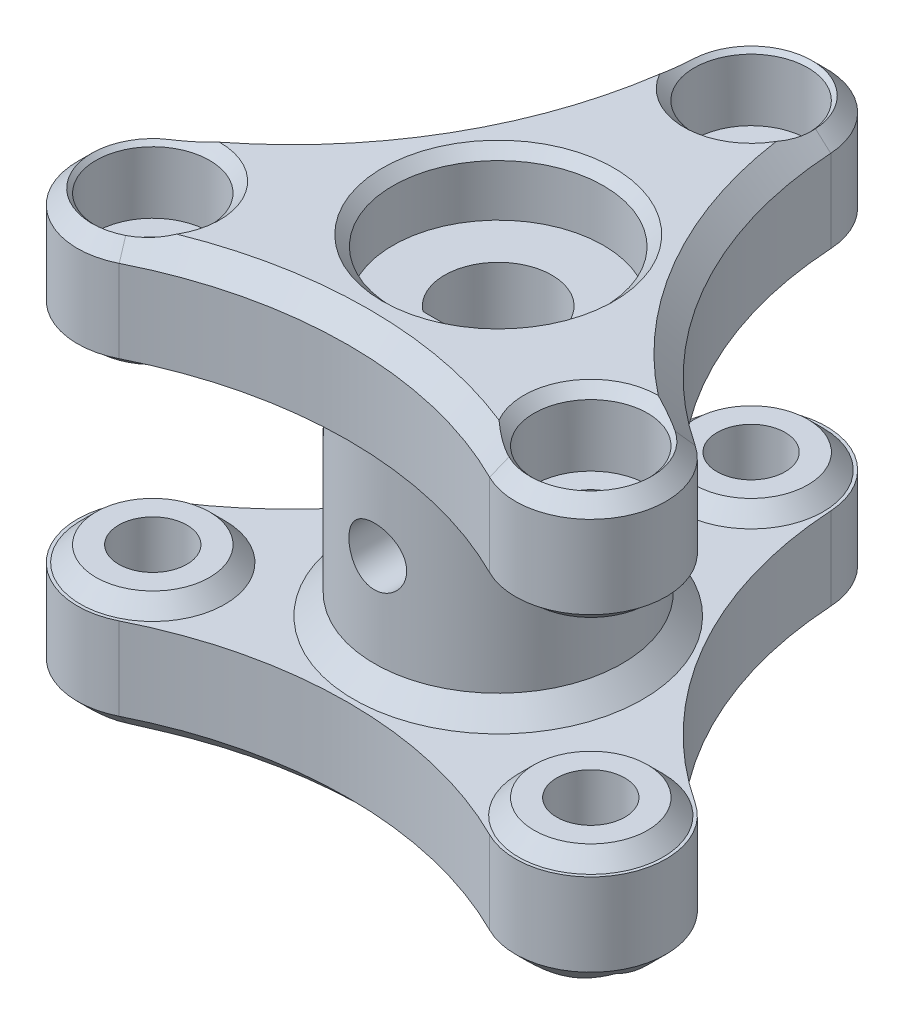
from build123d import *

# Parameters (mm, degrees)
SKETCH1_R           = 1.65
BOSS_EXTRUDE1_DEPTH = 5
SKETCH2_R           = 6
BOSS_EXTRUDE2_DEPTH = 11
SKETCH3_R           = 1.65
BOSS_EXTRUDE3_DEPTH = 5
SKETCH4_R           = 1.4
CUT_EXTRUDE1_DEPTH  = 30.952023249
FILLET1_SIZE        = 1
CUT_EXTRUDE2_DEPTH  = 3
SKETCH8_R           = 2.5
SKETCH8_R_2         = 1.65
BOSS_EXTRUDE5_DEPTH = 0.75
FILLET4_SIZE        = 1
BOSS_EXTRUDE6_START = 0.75
SKETCH9_R           = 2.5
SKETCH9_R_2         = 1.65
BOSS_EXTRUDE6_DEPTH = 0.75
FILLET5_SIZE        = 1
SKETCH12_R          = 2.75
CUT_EXTRUDE5_DEPTH  = 3.5
SKETCH10_R          = 5.1
CUT_EXTRUDE3_DEPTH  = 3
CUT_EXTRUDE4_START  = -3.5
SKETCH11_R          = 5.1
CUT_EXTRUDE4_DEPTH  = 3.5
CHAMFER1_SIZE       = 1
CHAMFER2_SIZE       = 1


with BuildPart() as part:
    # Sketch1 → Boss-Extrude1 (new body)
    with BuildSketch(Plane(origin=(0, 0, 0), x_dir=(1, 0, 0), z_dir=(0, 1, 0))):
        with BuildLine():
            ThreePointArc((-12.615282077, -3.075971531), (-13.76980392, -7.95), (-8.971510525, -9.387168989))
            ThreePointArc((-8.971510525, -9.387168989), (0, -7.262067559), (8.971510525, -9.387168989))
            ThreePointArc((8.971510525, -9.387168989), (13.76980392, -7.95), (12.615282077, -3.075971531))
            ThreePointArc((12.615282077, -3.075971531), (6.28913499, 3.63103378), (3.643771551, 12.46314052))
            ThreePointArc((3.643771551, 12.46314052), (0, 15.9), (-3.643771551, 12.46314052))
            ThreePointArc((-3.643771551, 12.46314052), (-6.28913499, 3.63103378), (-12.615282077, -3.075971531))
        make_face()
        with Locations(Location((0, 12.25, 0), (0, 0, 270))):
            Circle(SKETCH1_R, mode=Mode.SUBTRACT)
        with Locations(Location((10.608811196, -6.125, 0), (0, 0, 270))):
            Circle(SKETCH1_R, mode=Mode.SUBTRACT)
        with Locations(Location((-10.608811196, -6.125, 0), (0, 0, 270))):
            Circle(SKETCH1_R, mode=Mode.SUBTRACT)
        with BuildLine():
            Line((-1.599218559, -2.05), (1.599218559, -2.05))
            ThreePointArc((1.599218559, -2.05), (0, 2.6), (-1.599218559, -2.05))
        make_face(mode=Mode.SUBTRACT)
    extrude(amount=BOSS_EXTRUDE1_DEPTH)

    # Sketch2 → Boss-Extrude2 (add)
    with BuildSketch(Plane(origin=(0, 5, 0), x_dir=(1, 0, 0), z_dir=(0, 1, 0))):
        with Locations(Location((0, 0, 0), (0, 0, 90))):
            Circle(SKETCH2_R)
        with BuildLine():
            Line((-1.599218559, -2.05), (1.599218559, -2.05))
            ThreePointArc((1.599218559, -2.05), (0, 2.6), (-1.599218559, -2.05))
        make_face(mode=Mode.SUBTRACT)
    extrude(amount=BOSS_EXTRUDE2_DEPTH)

    # Sketch3 → Boss-Extrude3 (add)
    with BuildSketch(Plane(origin=(0, 16, 0), x_dir=(1, 0, 0), z_dir=(0, 1, 0))):
        with BuildLine():
            ThreePointArc((-12.615282077, -3.075971531), (-6.28913499, 3.63103378), (-3.643771551, 12.46314052))
            ThreePointArc((-3.643771551, 12.46314052), (0, 15.9), (3.643771551, 12.46314052))
            ThreePointArc((3.643771551, 12.46314052), (6.28913499, 3.63103378), (12.615282077, -3.075971531))
            ThreePointArc((12.615282077, -3.075971531), (13.76980392, -7.95), (8.971510525, -9.387168989))
            ThreePointArc((8.971510525, -9.387168989), (0, -7.262067559), (-8.971510525, -9.387168989))
            ThreePointArc((-8.971510525, -9.387168989), (-13.76980392, -7.95), (-12.615282077, -3.075971531))
        make_face()
        with Locations(Location((-10.608811196, -6.125, 0), (0, 0, 270))):
            Circle(SKETCH3_R, mode=Mode.SUBTRACT)
        with Locations(Location((10.608811196, -6.125, 0), (0, 0, 270))):
            Circle(SKETCH3_R, mode=Mode.SUBTRACT)
        with Locations(Location((0, 12.25, 0), (0, 0, 270))):
            Circle(SKETCH3_R, mode=Mode.SUBTRACT)
        with BuildLine():
            Line((-1.599218559, -2.05), (1.599218559, -2.05))
            ThreePointArc((1.599218559, -2.05), (0, 2.6), (-1.599218559, -2.05))
        make_face(mode=Mode.SUBTRACT)
    extrude(amount=BOSS_EXTRUDE3_DEPTH)

    # Sketch4 → Cut-Extrude1 (cut, through all)
    with BuildSketch(Plane.XY):
        with Locations(Location((0, 10.5, 0), (0, 0, 180))):
            Circle(SKETCH4_R)
    extrude(amount=CUT_EXTRUDE1_DEPTH, mode=Mode.SUBTRACT)

    # Fillet1
    fillet1_edges = [part.edges().sort_by_distance(p)[0] for p in [
        (0, 5, 6),
        (0, 16, 6),
    ]]
    chamfer(fillet1_edges, length=FILLET1_SIZE)

    # Sketch6 → Cut-Extrude2 (cut)
    with BuildSketch(Plane.XZ):
        Polygon((-13.358811196, 4.53728676), (-10.608811196, 2.949573519), (-7.858811196, 4.53728676), (-7.858811196, 7.71271324), (-10.608811196, 9.300426481), (-13.358811196, 7.71271324), align=None)
        Polygon((2.75, -13.83771324), (2.75, -10.66228676), (0, -9.074573519), (-2.75, -10.66228676), (-2.75, -13.83771324), (0, -15.425426481), align=None)
        Polygon((10.608811196, 9.300426481), (7.858811196, 7.71271324), (7.858811196, 4.53728676), (10.608811196, 2.949573519), (13.358811196, 4.53728676), (13.358811196, 7.71271324), align=None)
    extrude(amount=-CUT_EXTRUDE2_DEPTH, mode=Mode.SUBTRACT)

    # Sketch8 → Boss-Extrude5 (add)
    # profile 1 of 3: a face of its own
    with BuildSketch(Plane(origin=(0, 5, 0), x_dir=(1, 0, 0), z_dir=(0, 1, 0))):
        with Locations(Location((-10.608811196, -6.125, 0), (0, 0, 90))):
            Circle(SKETCH8_R)
        with Locations(Location((-10.608811196, -6.125, 0), (0, 0, 90))):
            Circle(SKETCH8_R_2, mode=Mode.SUBTRACT)
    # profile 2 of 3: a face of its own
    with BuildSketch(Plane(origin=(0, 5, 0), x_dir=(1, 0, 0), z_dir=(0, 1, 0))):
        with Locations(Location((0, 12.25, 0), (0, 0, 90))):
            Circle(SKETCH8_R)
        with Locations(Location((0, 12.25, 0), (0, 0, 90))):
            Circle(SKETCH8_R_2, mode=Mode.SUBTRACT)
    # profile 3 of 3: a face of its own
    with BuildSketch(Plane(origin=(0, 5, 0), x_dir=(1, 0, 0), z_dir=(0, 1, 0))):
        with Locations(Location((10.608811196, -6.125, 0), (0, 0, 90))):
            Circle(SKETCH8_R)
        with Locations(Location((10.608811196, -6.125, 0), (0, 0, 90))):
            Circle(SKETCH8_R_2, mode=Mode.SUBTRACT)
    extrude(amount=BOSS_EXTRUDE5_DEPTH)

    # Fillet4
    # the kernel refuses this chamfer: 1 mm, written as the material it adds along each edge
    with BuildSketch(Plane(origin=(0, 5, -12.25), x_dir=(0, 0, -1), z_dir=(1, 0, 0))) as fillet4_piece_1_section:
        Polygon((2.5 + FILLET4_SIZE, 0), (2.5, FILLET4_SIZE), (2.5, 0), align=None)
    fillet4_piece_1 = revolve(axis=Axis((0, 5, -12.25), (0, 1, 0)), mode=Mode.PRIVATE)
    fillet4_piece_1 = split(fillet4_piece_1, bisect_by=Plane(origin=(0, 5.75, -12.25), z_dir=(0, -1, 0)), keep=Keep.TOP, mode=Mode.PRIVATE)
    add(fillet4_piece_1)
    with BuildSketch(Plane(origin=(10.608811196, 5, 6.125), x_dir=(0, 0, -1), z_dir=(1, 0, 0))) as fillet4_piece_2_section:
        Polygon((2.5 + FILLET4_SIZE, 0), (2.5, FILLET4_SIZE), (2.5, 0), align=None)
    fillet4_piece_2 = revolve(axis=Axis((10.608811196, 5, 6.125), (0, 1, 0)), mode=Mode.PRIVATE)
    fillet4_piece_2 = split(fillet4_piece_2, bisect_by=Plane(origin=(10.608811196, 5.75, 6.125), z_dir=(0, -1, 0)), keep=Keep.TOP, mode=Mode.PRIVATE)
    add(fillet4_piece_2)
    with BuildSketch(Plane(origin=(-10.608811196, 5, 6.125), x_dir=(0, 0, -1), z_dir=(1, 0, 0))) as fillet4_piece_3_section:
        Polygon((2.5 + FILLET4_SIZE, 0), (2.5, FILLET4_SIZE), (2.5, 0), align=None)
    fillet4_piece_3 = revolve(axis=Axis((-10.608811196, 5, 6.125), (0, 1, 0)), mode=Mode.PRIVATE)
    fillet4_piece_3 = split(fillet4_piece_3, bisect_by=Plane(origin=(-10.608811196, 5.75, 6.125), z_dir=(0, -1, 0)), keep=Keep.TOP, mode=Mode.PRIVATE)
    add(fillet4_piece_3)

    # Sketch9 → Boss-Extrude6 (add)
    # profile 1 of 3: a face of its own
    with BuildSketch(Plane.XZ.offset(-16).offset(BOSS_EXTRUDE6_START)):
        with Locations(Location((0, -12.25, 0), (0, 0, 90))):
            Circle(SKETCH9_R)
        with Locations(Location((0, -12.25, 0), (0, 0, 270))):
            Circle(SKETCH9_R_2, mode=Mode.SUBTRACT)
    # profile 2 of 3: a face of its own
    with BuildSketch(Plane.XZ.offset(-16).offset(BOSS_EXTRUDE6_START)):
        with Locations(Location((-10.608811196, 6.125, 0), (0, 0, 90))):
            Circle(SKETCH9_R)
        with Locations(Location((-10.608811196, 6.125, 0), (0, 0, 270))):
            Circle(SKETCH9_R_2, mode=Mode.SUBTRACT)
    # profile 3 of 3: a face of its own
    with BuildSketch(Plane.XZ.offset(-16).offset(BOSS_EXTRUDE6_START)):
        with Locations(Location((10.608811196, 6.125, 0), (0, 0, 90))):
            Circle(SKETCH9_R)
        with Locations(Location((10.608811196, 6.125, 0), (0, 0, 270))):
            Circle(SKETCH9_R_2, mode=Mode.SUBTRACT)
    extrude(amount=-BOSS_EXTRUDE6_DEPTH)

    # Fillet5
    # the kernel refuses this chamfer: 1 mm, written as the material it adds along each edge
    with BuildSketch(Plane(origin=(10.608811196, 16, 6.125), x_dir=(0, 0, 1), z_dir=(1, 0, 0))) as fillet5_piece_1_section:
        Polygon((2.5 + FILLET5_SIZE, 0), (2.5, FILLET5_SIZE), (2.5, 0), align=None)
    fillet5_piece_1 = revolve(axis=Axis((10.608811196, 16, 6.125), (0, -1, 0)), mode=Mode.PRIVATE)
    fillet5_piece_1 = split(fillet5_piece_1, bisect_by=Plane(origin=(10.608811196, 15.25, 6.125), z_dir=(0, 1, 0)), keep=Keep.TOP, mode=Mode.PRIVATE)
    add(fillet5_piece_1)
    with BuildSketch(Plane(origin=(-10.608811196, 16, 6.125), x_dir=(0, 0, 1), z_dir=(1, 0, 0))) as fillet5_piece_2_section:
        Polygon((2.5 + FILLET5_SIZE, 0), (2.5, FILLET5_SIZE), (2.5, 0), align=None)
    fillet5_piece_2 = revolve(axis=Axis((-10.608811196, 16, 6.125), (0, -1, 0)), mode=Mode.PRIVATE)
    fillet5_piece_2 = split(fillet5_piece_2, bisect_by=Plane(origin=(-10.608811196, 15.25, 6.125), z_dir=(0, 1, 0)), keep=Keep.TOP, mode=Mode.PRIVATE)
    add(fillet5_piece_2)
    with BuildSketch(Plane(origin=(0, 16, -12.25), x_dir=(0, 0, 1), z_dir=(1, 0, 0))) as fillet5_piece_3_section:
        Polygon((2.5 + FILLET5_SIZE, 0), (2.5, FILLET5_SIZE), (2.5, 0), align=None)
    fillet5_piece_3 = revolve(axis=Axis((0, 16, -12.25), (0, -1, 0)), mode=Mode.PRIVATE)
    fillet5_piece_3 = split(fillet5_piece_3, bisect_by=Plane(origin=(0, 15.25, -12.25), z_dir=(0, 1, 0)), keep=Keep.TOP, mode=Mode.PRIVATE)
    add(fillet5_piece_3)

    # Sketch12 → Cut-Extrude5 (cut)
    with BuildSketch(Plane(origin=(0, 21, 0), x_dir=(1, 0, 0), z_dir=(0, 1, 0))):
        with Locations(Location((0, 12.25, 0), (0, 0, 270))):
            Circle(SKETCH12_R)
        with Locations(Location((10.608811196, -6.125, 0), (0, 0, 270))):
            Circle(SKETCH12_R)
        with Locations(Location((-10.608811196, -6.125, 0), (0, 0, 270))):
            Circle(SKETCH12_R)
    extrude(amount=-CUT_EXTRUDE5_DEPTH, mode=Mode.SUBTRACT)

    # Sketch10 → Cut-Extrude3 (cut)
    with BuildSketch(Plane(origin=(0, 21, 0), x_dir=(1, 0, 0), z_dir=(0, 1, 0))):
        with Locations(Location((0, 0, 0), (0, 0, 270))):
            Circle(SKETCH10_R)
    extrude(amount=-CUT_EXTRUDE3_DEPTH, mode=Mode.SUBTRACT)

    # Sketch11 → Cut-Extrude4 (cut)
    with BuildSketch(Plane.XZ.offset(CUT_EXTRUDE4_START)):
        with Locations(Location((0, 0, 0), (0, 0, 90))):
            Circle(SKETCH11_R)
    extrude(amount=CUT_EXTRUDE4_DEPTH, mode=Mode.SUBTRACT)

    # Chamfer1
    # the kernel refuses this chamfer: 1 mm, written as the material it takes off along each edge
    with BuildSketch(Plane(origin=(-10.608811196, 21, 6.125), x_dir=(0.44857552627312325, 0, 0.8937449285052143), z_dir=(0.8937449285052143, 0, -0.44857552627312325))) as chamfer1_piece_1:
        Polygon((3.65, CHAMFER1_SIZE), (3.65 - CHAMFER1_SIZE, 0), (3.65, 0), align=None)
    revolve(axis=Axis((-10.608811196, 21, 6.125), (0, -1, 0)), revolution_arc=173.30465573, mode=Mode.SUBTRACT)
    with BuildSketch(Plane(origin=(0, 21, 27.262067559), x_dir=(0.4485755262731226, 0, -0.8937449285052146), z_dir=(0.8937449285052146, 0, 0.4485755262731226))) as chamfer1_piece_2:
        Polygon((20, -CHAMFER1_SIZE), (20 + CHAMFER1_SIZE, 0), (20, 0), align=None)
    revolve(axis=Axis((0, 21, 27.262067559), (0, 1, 0)), revolution_arc=53.30465573, mode=Mode.SUBTRACT)
    with BuildSketch(Plane(origin=(10.608811196, 21, 6.125), x_dir=(0.5497180494524583, 0, -0.8353502655211075), z_dir=(-0.8353502655211075, 0, -0.5497180494524583))) as chamfer1_piece_3:
        Polygon((3.65, CHAMFER1_SIZE), (3.65 - CHAMFER1_SIZE, 0), (3.65, 0), align=None)
    revolve(axis=Axis((10.608811196, 21, 6.125), (0, -1, 0)), revolution_arc=173.30465573, mode=Mode.SUBTRACT)
    with BuildSketch(Plane(origin=(23.609643066, 21, -13.63103378), x_dir=(-0.9982935757255842, 0, 0.05839466298410776), z_dir=(-0.05839466298410776, 0, -0.9982935757255842))) as chamfer1_piece_4:
        Polygon((20, -CHAMFER1_SIZE), (20 + CHAMFER1_SIZE, 0), (20, 0), align=None)
    revolve(axis=Axis((23.609643066, 21, -13.63103378), (0, 1, 0)), revolution_arc=53.30465573, mode=Mode.SUBTRACT)
    with BuildSketch(Plane(origin=(0, 21, -12.25), x_dir=(-0.9982935757255842, 0, -0.05839466298410582), z_dir=(-0.05839466298410582, 0, 0.9982935757255842))) as chamfer1_piece_5:
        Polygon((3.65, CHAMFER1_SIZE), (3.65 - CHAMFER1_SIZE, 0), (3.65, 0), align=None)
    revolve(axis=Axis((0, 21, -12.25), (0, -1, 0)), revolution_arc=173.30465573, mode=Mode.SUBTRACT)
    with BuildSketch(Plane(origin=(-23.609643066, 21, -13.63103378), x_dir=(0.549718049452461, 0, 0.8353502655211055), z_dir=(-0.8353502655211055, 0, 0.549718049452461))) as chamfer1_piece_6:
        Polygon((20, -CHAMFER1_SIZE), (20 + CHAMFER1_SIZE, 0), (20, 0), align=None)
    revolve(axis=Axis((-23.609643066, 21, -13.63103378), (0, 1, 0)), revolution_arc=53.30465573, mode=Mode.SUBTRACT)

    # Chamfer2
    # the kernel refuses this chamfer: 1 mm, written as the material it takes off along each edge
    with BuildSketch(Plane(origin=(0, 0, -12.25), x_dir=(0.9982935757255841, 0, -0.05839466298410828), z_dir=(0.05839466298410828, 0, 0.9982935757255841))) as chamfer2_piece_1:
        Polygon((3.65, CHAMFER2_SIZE), (3.65 - CHAMFER2_SIZE, 0), (3.65, 0), align=None)
    revolve(axis=Axis((0, 0, -12.25), (0, 1, 0)), revolution_arc=173.30465573, mode=Mode.SUBTRACT)
    with BuildSketch(Plane(origin=(-23.609643066, 0, -13.63103378), x_dir=(0.998293575725584, 0, 0.05839466298410882), z_dir=(0.05839466298410882, 0, -0.998293575725584))) as chamfer2_piece_2:
        Polygon((20, -CHAMFER2_SIZE), (20 + CHAMFER2_SIZE, 0), (20, 0), align=None)
    revolve(axis=Axis((-23.609643066, 0, -13.63103378), (0, -1, 0)), revolution_arc=53.30465573, mode=Mode.SUBTRACT)
    with BuildSketch(Plane(origin=(23.609643066, 0, -13.63103378), x_dir=(-0.5497180494524619, 0, 0.8353502655211049), z_dir=(0.8353502655211049, 0, 0.5497180494524619))) as chamfer2_piece_3:
        Polygon((20, -CHAMFER2_SIZE), (20 + CHAMFER2_SIZE, 0), (20, 0), align=None)
    revolve(axis=Axis((23.609643066, 0, -13.63103378), (0, -1, 0)), revolution_arc=53.30465573, mode=Mode.SUBTRACT)
    with BuildSketch(Plane(origin=(-10.608811196, 0, 6.125), x_dir=(-0.5497180494524605, 0, -0.835350265521106), z_dir=(0.835350265521106, 0, -0.5497180494524605))) as chamfer2_piece_4:
        Polygon((3.65, CHAMFER2_SIZE), (3.65 - CHAMFER2_SIZE, 0), (3.65, 0), align=None)
    revolve(axis=Axis((-10.608811196, 0, 6.125), (0, 1, 0)), revolution_arc=173.30465573, mode=Mode.SUBTRACT)
    with BuildSketch(Plane(origin=(10.608811196, 0, 6.125), x_dir=(-0.4485755262731232, 0, 0.8937449285052141), z_dir=(-0.8937449285052141, 0, -0.4485755262731232))) as chamfer2_piece_5:
        Polygon((3.65, CHAMFER2_SIZE), (3.65 - CHAMFER2_SIZE, 0), (3.65, 0), align=None)
    revolve(axis=Axis((10.608811196, 0, 6.125), (0, 1, 0)), revolution_arc=173.30465573, mode=Mode.SUBTRACT)
    with BuildSketch(Plane(origin=(0, 0, 27.262067559), x_dir=(-0.4485755262731224, 0, -0.8937449285052146), z_dir=(-0.8937449285052146, 0, 0.4485755262731224))) as chamfer2_piece_6:
        Polygon((20, -CHAMFER2_SIZE), (20 + CHAMFER2_SIZE, 0), (20, 0), align=None)
    revolve(axis=Axis((0, 0, 27.262067559), (0, -1, 0)), revolution_arc=53.30465573, mode=Mode.SUBTRACT)

    # Chamfer3: read off the stored shape, not the designer's step
    # Chamfer3: loft between two sections, ruled curve by curve
    chamfer3_from = [
        Edge.make_three_point_arc((0, 0.5, -5.1), (5.1, 0.5, 0), (0, 0.5, 5.1)),
        Edge.make_three_point_arc((0, 0.5, 5.1), (-5.1, 0.5, 0), (0, 0.5, -5.1)),
    ]
    chamfer3_to = [
        Edge.make_three_point_arc((0, 0, -5.6), (5.6, 0, 0), (0, 0, 5.6)),
        Edge.make_three_point_arc((0, 0, 5.6), (-5.6, 0, 0), (0, 0, -5.6)),
    ]
    chamfer3 = Solid(Shell([*[Face.make_surface_from_curves(chamfer3_from[k], chamfer3_to[k]) for k in range(2)], Face(Wire(chamfer3_from)), Face(Wire(chamfer3_to))]))
    add(chamfer3, mode=Mode.SUBTRACT)

    # Chamfer3 2: loft between two sections, ruled curve by curve
    chamfer3_2_from = [
        Edge.make_three_point_arc((0, 20.5, 5.1), (5.1, 20.5, 0), (0, 20.5, -5.1)),
        Edge.make_three_point_arc((0, 20.5, -5.1), (-5.1, 20.5, 0), (0, 20.5, 5.1)),
    ]
    chamfer3_2_to = [
        Edge.make_three_point_arc((0, 21, 5.6), (5.6, 21, 0), (0, 21, -5.6)),
        Edge.make_three_point_arc((0, 21, -5.6), (-5.6, 21, 0), (0, 21, 5.6)),
    ]
    chamfer3_2 = Solid(Shell([*[Face.make_surface_from_curves(chamfer3_2_from[k], chamfer3_2_to[k]) for k in range(2)], Face(Wire(chamfer3_2_from)), Face(Wire(chamfer3_2_to))]))
    add(chamfer3_2, mode=Mode.SUBTRACT)

    # Chamfer3 3: loft between two sections, ruled curve by curve
    chamfer3_3_from = [
        Edge.make_three_point_arc((10.624196876, 20.5, 3.37504304), (7.858854237, 20.5, 6.10961432), (10.593425516, 20.5, 8.87495696)),
        Edge.make_three_point_arc((10.593425516, 20.5, 8.87495696), (13.358768156, 20.5, 6.14038568), (10.624196876, 20.5, 3.37504304)),
    ]
    chamfer3_3_to = [
        Edge.make_three_point_arc((10.626994273, 21.000000086, 2.87505078), (7.358861976, 21.000000086, 6.106816923), (10.590628119, 21.000000086, 9.37494922)),
        Edge.make_three_point_arc((10.590628119, 21.000000086, 9.37494922), (13.858760417, 21.000000086, 6.143183077), (10.626994273, 21.000000086, 2.87505078)),
    ]
    chamfer3_3 = Solid(Shell([*[Face.make_surface_from_curves(chamfer3_3_from[k], chamfer3_3_to[k]) for k in range(2)], Face(Wire(chamfer3_3_from)), Face(Wire(chamfer3_3_to))]))
    add(chamfer3_3, mode=Mode.SUBTRACT)

    # Chamfer3 4: loft between two sections, ruled curve by curve
    chamfer3_4_from = [
        Edge.make_three_point_arc((-2.389225427, 20.5, -10.88834591), (1.36165409, 20.5, -9.860774573), (2.389225427, 20.5, -13.61165409)),
        Edge.make_three_point_arc((2.389225427, 20.5, -13.61165409), (-1.36165409, 20.5, -14.639225427), (-2.389225427, 20.5, -10.88834591)),
    ]
    chamfer3_4_to = [
        Edge.make_three_point_arc((-2.823630124, 21.000000086, -10.640772396), (1.609227604, 21.000000086, -9.426369876), (2.823630124, 21.000000086, -13.859227604)),
        Edge.make_three_point_arc((2.823630124, 21.000000086, -13.859227604), (-1.609227604, 21.000000086, -15.073630124), (-2.823630124, 21.000000086, -10.640772396)),
    ]
    chamfer3_4 = Solid(Shell([*[Face.make_surface_from_curves(chamfer3_4_from[k], chamfer3_4_to[k]) for k in range(2)], Face(Wire(chamfer3_4_from)), Face(Wire(chamfer3_4_to))]))
    add(chamfer3_4, mode=Mode.SUBTRACT)

    # Chamfer3 5: loft between two sections, ruled curve by curve
    chamfer3_5_from = [
        Edge.make_three_point_arc((-8.23497145, 20.5, 7.51330287), (-9.220508327, 20.5, 3.751160254), (-12.982650943, 20.5, 4.73669713)),
        Edge.make_three_point_arc((-12.982650943, 20.5, 4.73669713), (-11.997114066, 20.5, 8.498839746), (-8.23497145, 20.5, 7.51330287)),
    ]
    chamfer3_5_to = [
        Edge.make_three_point_arc((-7.803364149, 21.000000086, 7.765721617), (-8.96808958, 21.000000086, 3.319552953), (-13.414258244, 21.000000086, 4.484278383)),
        Edge.make_three_point_arc((-13.414258244, 21.000000086, 4.484278383), (-12.249532813, 21.000000086, 8.930447047), (-7.803364149, 21.000000086, 7.765721617)),
    ]
    chamfer3_5 = Solid(Shell([*[Face.make_surface_from_curves(chamfer3_5_from[k], chamfer3_5_to[k]) for k in range(2)], Face(Wire(chamfer3_5_from)), Face(Wire(chamfer3_5_to))]))
    add(chamfer3_5, mode=Mode.SUBTRACT)


solid = part.part
